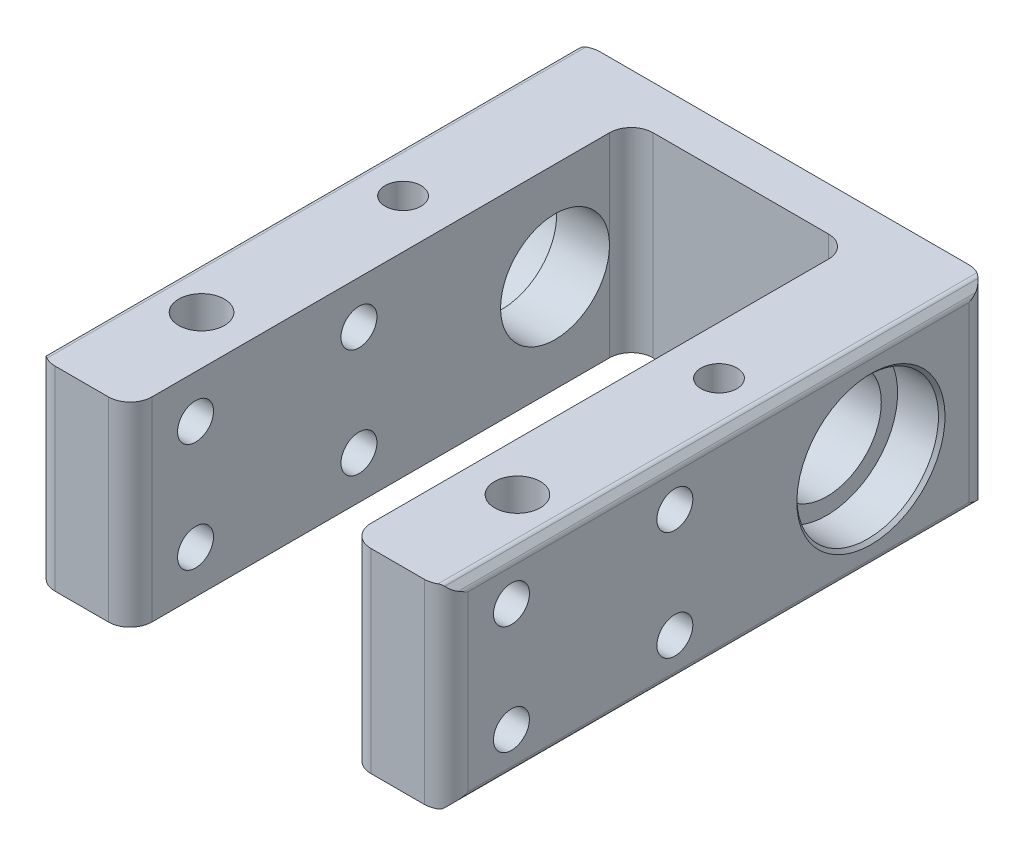
from build123d import *

# Parameters (mm, degrees)
SKETCH_1_W             = 37.9
SKETCH_1_H             = 17.9
EXTRUDE_1_DEPTH        = 20
CHAMFER_1_SIZE         = 0.8
FILLET_1_R             = 0.5
SKETCH_2_R             = 6.5
CUT_EXTRUDE_1_DEPTH    = 4.05
SKETCH_3_R             = 5
CUT_EXTRUDE_2_DEPTH    = 64
CHAMFER_2_SIZE         = 0.3
HOLE_WIZARD_M4_1_D     = 3.3
HOLE_WIZARD_M4_1_DEPTH = 20
HOLE_WIZARD_M4_1_TIP   = 0.991420021
HOLE_WIZARD_M4_2_D     = 3.3
HOLE_WIZARD_M4_2_DEPTH = 42.1
HOLE_WIZARD_M4_2_TIP   = 0.991420021
EXTRUDE_2_DEPTH        = 10
SKETCH_17_W            = 20.1
SKETCH_17_H            = 46
CUT_EXTRUDE_5_DEPTH    = 25
FILLET_2_R             = 2
SKETCH_18_R            = 2.1
CUT_EXTRUDE_6_DEPTH    = 35
FILLET_4_R             = 2
HOLE_WIZARD_M4_4_D     = 3.3
HOLE_WIZARD_M4_4_DEPTH = 42.1
HOLE_WIZARD_M4_4_TIP   = 0.991420021


# Some blends are built 0.0001 mm under size
with BuildPart() as part:
    # 草图1 → 凸台-拉伸1 (new, symmetric)
    with BuildSketch(Plane.XY):
        Rectangle(SKETCH_1_W, SKETCH_1_H)
    extrude(amount=EXTRUDE_1_DEPTH, both=True)

    # 倒角1
    chamfer_1_edges = [part.edges().sort_by_distance(p)[0] for p in [
        (-18.95, -8.95, 0),
        (-18.95, 8.95, 0),
        (18.95, 8.95, 0),
        (18.95, -8.95, 0),
    ]]
    chamfer(chamfer_1_edges, length=CHAMFER_1_SIZE)

    # 圆角1
    fillet_1_edges = [part.edges().sort_by_distance(p)[0] for p in [
        (18.15, -8.95, 0),
        (-18.15, -8.95, 0),
        (-18.95, 8.15, 0),
        (-18.95, -8.15, 0),
        (18.95, 8.15, 0),
        (18.95, -8.15, 0),
        (18.15, 8.95, 0),
        (-18.15, 8.95, 0),
    ]]
    fillet(fillet_1_edges, radius=FILLET_1_R)

    # 草图2 → 切除-拉伸1 (cut)
    with BuildSketch(Plane.ZY.offset(18.95)):
        with Locations((-9, 0)):
            Circle(SKETCH_2_R)
    cut_extrude_1 = extrude(amount=-CUT_EXTRUDE_1_DEPTH, mode=Mode.SUBTRACT)

    # 草图3 → 切除-拉伸2 (cut)
    with BuildSketch(Plane.ZY.offset(14.9)):
        with Locations((-9, 0)):
            Circle(SKETCH_3_R)
    extrude(amount=-CUT_EXTRUDE_2_DEPTH, mode=Mode.SUBTRACT)

    # 镜向1: 切除-拉伸1 across plane
    add(cut_extrude_1.mirror(Plane(origin=(0, 0, 0), x_dir=(0, 0, 1), z_dir=(1, 0, 0))), mode=Mode.SUBTRACT)

    # 倒角2
    chamfer_2_edges = [part.edges().sort_by_distance(p)[0] for p in [
        (-18.95, 0, -15.5),
        (18.95, 0, -15.5),
    ]]
    chamfer(chamfer_2_edges, length=CHAMFER_2_SIZE)

    # M4 螺纹孔1
    with Locations(Plane(origin=(0, 8.95, 0), x_dir=(1, 0, 0), z_dir=(0, 1, 0))):
        with Locations((-14.5, -0.5), (14.5, -0.5)):
            Hole(HOLE_WIZARD_M4_1_D / 2, depth=HOLE_WIZARD_M4_1_DEPTH)
            with Locations((0, 0, -(HOLE_WIZARD_M4_1_DEPTH + HOLE_WIZARD_M4_1_TIP / 2))):  # 118° drill point
                Cone(0, HOLE_WIZARD_M4_1_D / 2, HOLE_WIZARD_M4_1_TIP, mode=Mode.SUBTRACT)

    # M4 螺纹孔2
    with Locations(Plane(origin=(18.95, 0, 0), x_dir=(0, 0, -1), z_dir=(1, 0, 0))):
        with Locations((-9, 5), (-9, -5)):
            Hole(HOLE_WIZARD_M4_2_D / 2, depth=HOLE_WIZARD_M4_2_DEPTH)
            with Locations((0, 0, -(HOLE_WIZARD_M4_2_DEPTH + HOLE_WIZARD_M4_2_TIP / 2))):  # 118° drill point
                Cone(0, HOLE_WIZARD_M4_2_D / 2, HOLE_WIZARD_M4_2_TIP, mode=Mode.SUBTRACT)

    # 草图13 → 凸台-拉伸2 (add)
    with BuildSketch(Plane.XY.offset(20)):
        with BuildLine():
            Line((-17.942893219, -8.95), (17.942893219, -8.95))
            ThreePointArc((17.942893219, -8.95), (18.134234935, -8.911939766), (18.296446609, -8.803553391))
            Line((18.296446609, -8.803553391), (18.803553391, -8.296446609))
            ThreePointArc((18.803553391, -8.296446609), (18.911939766, -8.134234935), (18.95, -7.942893219))
            Line((18.95, -7.942893219), (18.95, 7.942893219))
            ThreePointArc((18.95, 7.942893219), (18.911939766, 8.134234935), (18.803553391, 8.296446609))
            Line((18.803553391, 8.296446609), (18.296446609, 8.803553391))
            ThreePointArc((18.296446609, 8.803553391), (18.134234935, 8.911939766), (17.942893219, 8.95))
            Line((17.942893219, 8.95), (-17.942893219, 8.95))
            ThreePointArc((-17.942893219, 8.95), (-18.134234935, 8.911939766), (-18.296446609, 8.803553391))
            Line((-18.296446609, 8.803553391), (-18.803553391, 8.296446609))
            ThreePointArc((-18.803553391, 8.296446609), (-18.911939766, 8.134234935), (-18.95, 7.942893219))
            Line((-18.95, 7.942893219), (-18.95, -7.942893219))
            ThreePointArc((-18.95, -7.942893219), (-18.911939766, -8.134234935), (-18.803553391, -8.296446609))
            Line((-18.803553391, -8.296446609), (-18.296446609, -8.803553391))
            ThreePointArc((-18.296446609, -8.803553391), (-18.134234935, -8.911939766), (-17.942893219, -8.95))
        make_face()
    extrude(amount=EXTRUDE_2_DEPTH)

    # 草图17 → 切除-拉伸5 (cut)
    with BuildSketch(Plane(origin=(0, 8.95, 0), x_dir=(1, 0, 0), z_dir=(0, 1, 0))):
        with Locations((0, -7)):
            Rectangle(SKETCH_17_W, SKETCH_17_H)
    extrude(amount=-CUT_EXTRUDE_5_DEPTH, mode=Mode.SUBTRACT)

    # 圆角2
    fillet_2_edges = [part.edges().sort_by_distance(p)[0] for p in [
        (-10.05, 0, -16),
        (10.05, 0, -16),
    ]]
    fillet(fillet_2_edges, radius=FILLET_2_R - 0.0001)  # a hair under: the kernel refuses the full size
    fillet_2_2_edges = [part.edges().sort_by_distance(p)[0] for p in [
        (10.05, 0, 30),
        (-10.05, 0, 30),
    ]]
    fillet(fillet_2_2_edges, radius=FILLET_2_R)

    # 草图18 → 切除-拉伸6 (cut)
    with BuildSketch(Plane.XZ.offset(8.95)):
        with Locations(Location((-14.5, 19, 0), (0, 0, 270))):
            Circle(SKETCH_18_R)
        with Locations(Location((14.5, 19, 0), (0, 0, 270))):
            Circle(SKETCH_18_R)
    extrude(amount=-CUT_EXTRUDE_6_DEPTH, mode=Mode.SUBTRACT)

    # 圆角4
    # the kernel refuses this fillet: 2 mm, written as the material it takes off along each edge
    with BuildSketch(Plane(origin=(-18.95, -12.942893219, -20), x_dir=(1, 0, 0), z_dir=(0, 1, 0)), Plane(origin=(18.95, 12.942893219, -20), x_dir=(-1, 0, 0), z_dir=(0, -1, 0)), Plane(origin=(18.95, -12.942893219, 30), x_dir=(-1, 0, 0), z_dir=(0, 1, 0)), Plane(origin=(-18.95, 12.942893219, 30), x_dir=(1, 0, 0), z_dir=(0, -1, 0))) as fillet_4_piece_1:
        with BuildLine():
            CenterArc((FILLET_4_R, -FILLET_4_R), FILLET_4_R, 90, 90)
            Line((0, -FILLET_4_R), (0, 0))
            Line((0, 0), (FILLET_4_R, 0))
        make_face()
    extrude(amount=25.885786438, mode=Mode.SUBTRACT)

    # M4 螺纹孔4
    with Locations(Plane(origin=(18.95, 0, 0), x_dir=(0, 0, -1), z_dir=(1, 0, 0))):
        with Locations((-24, 5), (-24, -5)):
            Hole(HOLE_WIZARD_M4_4_D / 2, depth=HOLE_WIZARD_M4_4_DEPTH)
            with Locations((0, 0, -(HOLE_WIZARD_M4_4_DEPTH + HOLE_WIZARD_M4_4_TIP / 2))):  # 118° drill point
                Cone(0, HOLE_WIZARD_M4_4_D / 2, HOLE_WIZARD_M4_4_TIP, mode=Mode.SUBTRACT)


solid = part.part
